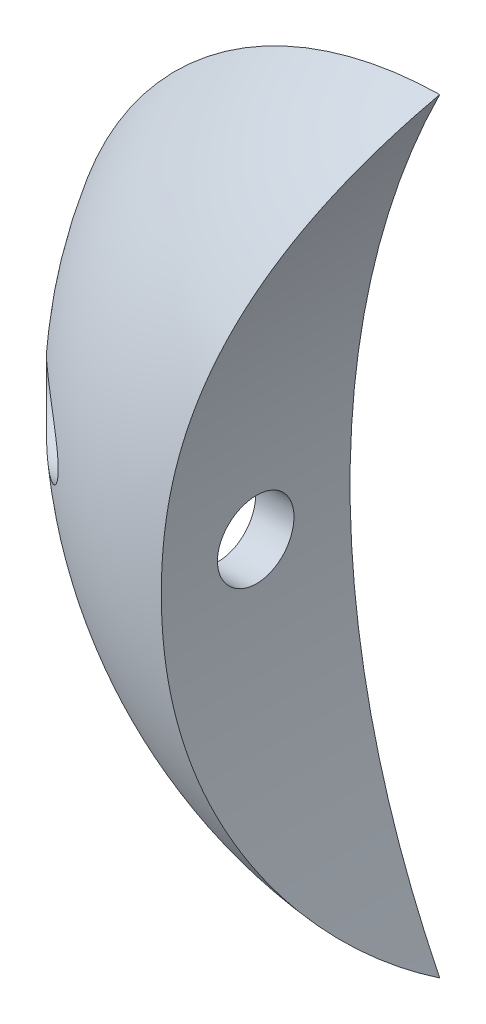
from build123d import *

# Parameters (mm, degrees)
BOSS_EXTRUDE1_DEPTH = 5
FILLET1_R           = 10
SHELL1_T            = -1
SKETCH4_R           = 1
CUT_EXTRUDE1_DEPTH  = 15.976807967


with BuildPart() as part:
    # Sketch1 → Boss-Extrude1 (new body)
    with BuildSketch(Plane.XY):
        with BuildLine():
            ThreePointArc((-0.15625, 9.998779222), (-10, 0), (-0.15625, -9.998779222))
            ThreePointArc((-0.15625, -9.998779222), (-2.5, 0), (-0.15625, 9.998779222))
        make_face()
    extrude(amount=BOSS_EXTRUDE1_DEPTH)

    # Fillet1
    # the kernel refuses this fillet: 10 mm, written as the material it takes off along each edge
    with BuildSketch(Plane(origin=(0, 0, 5), x_dir=(0.9999950652018581, 0.003141587485880102, 0), z_dir=(0.003141587485880102, -0.9999950652018581, 0))) as fillet1_piece_1:
        with BuildLine():
            CenterArc((1.339745962, -10), FILLET1_R, 30, 60)
            Line((1.339745962, 0), (1.339745962, 0.2))
            Line((1.339745962, 0.2), (10, 0.2))
            Line((10, 0.2), (10.2, 0))
            ThreePointArc((10.2, 0), (10.2, -2.5), (10.173205081, -4.9))
            Line((10.173205081, -4.9), (10, -5))
        make_face()
    revolve(axis=Axis((0, 0, 5), (0, 0, 1)), revolution_arc=359.64, mode=Mode.SUBTRACT)

    # Shell1
    shell1_openings = [part.faces().sort_by_distance(p)[0] for p in [
        (-5.162614347, 0, 0),
    ]]
    offset(amount=SHELL1_T, openings=shell1_openings, kind=Kind.INTERSECTION)

    # Sketch4 → Cut-Extrude1 (cut, through all)
    with BuildSketch(Plane(origin=(0, 0, 0), x_dir=(0, 0, -1), z_dir=(1, 0, 0))):
        with Locations(Location((-2.466231233, 0, 0), (0, 0, 324.775001353))):
            Circle(SKETCH4_R)
    extrude(amount=-CUT_EXTRUDE1_DEPTH, mode=Mode.SUBTRACT)


solid = part.part
